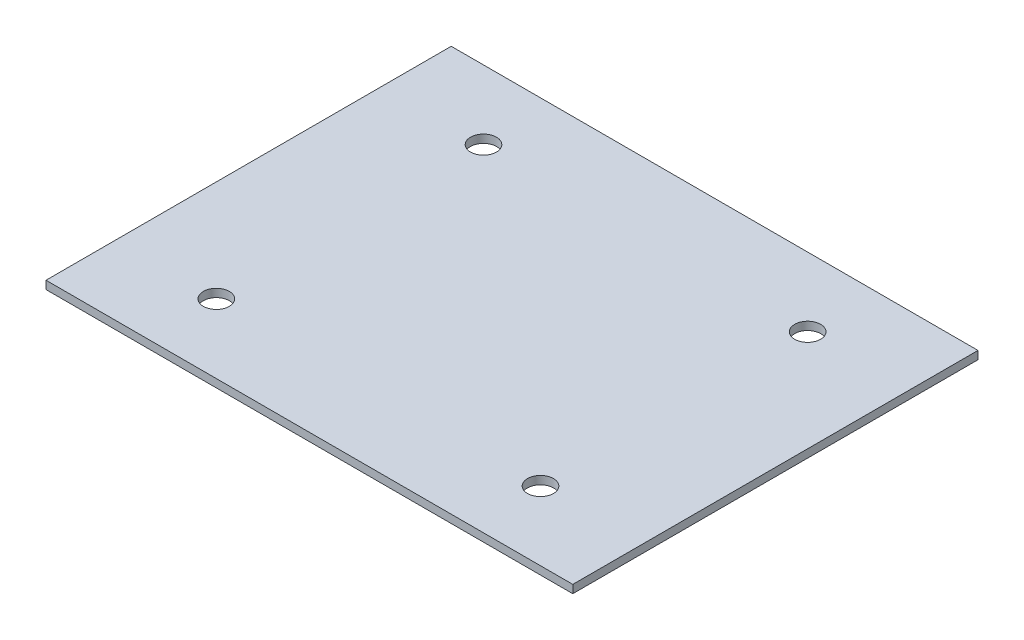
from build123d import *

# Parameters (mm, degrees)
SKETCH_1_W      = 130
SKETCH_1_H      = 100
SKETCH_1_R      = 3.2
EXTRUDE_1_DEPTH = 2


with BuildPart() as part:
    # Эскиз1 → Бобышка-Вытянуть1 (new body)
    with BuildSketch(Plane(origin=(0, 0, 0), x_dir=(1, 0, 0), z_dir=(0, 1, 0))):
        with Locations((65, 50)):
            Rectangle(SKETCH_1_W, SKETCH_1_H)
        with Locations((105, 17.034247801)):
            Circle(SKETCH_1_R, mode=Mode.SUBTRACT)
        with Locations((25, 17.034247801)):
            Circle(SKETCH_1_R, mode=Mode.SUBTRACT)
        with Locations((105, 82.965752199)):
            Circle(SKETCH_1_R, mode=Mode.SUBTRACT)
        with Locations((25, 82.965752199)):
            Circle(SKETCH_1_R, mode=Mode.SUBTRACT)
    extrude(amount=EXTRUDE_1_DEPTH)


solid = part.part
